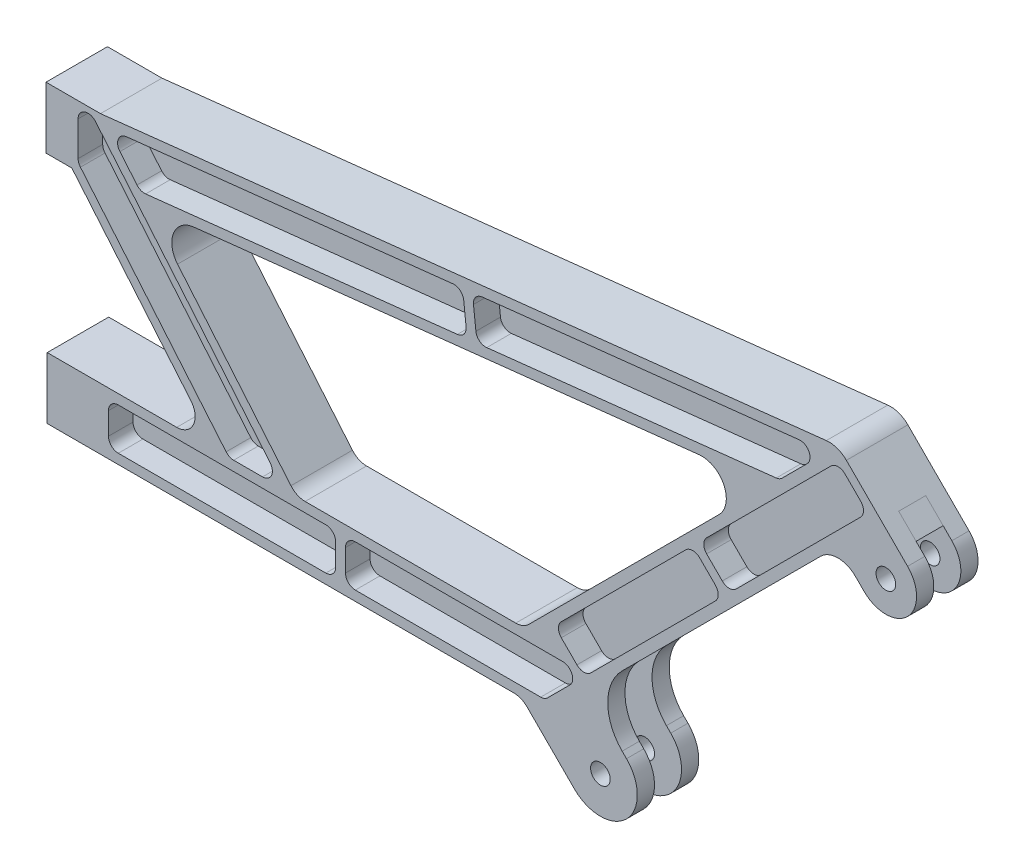
from build123d import *

# Parameters (mm, degrees)
SKETCH1_R               = 4
BOSS_EXTRUDE1_DEPTH     = 25
CUT_EXTRUDE1_DEPTH      = 10
CUT_EXTRUDE2_DEPTH      = 5.5
CUT_EXTRUDE2_DEPTH_BACK = 5.5
SKETCH4_W               = 11
SKETCH4_H               = 25.001230537
BOSS_EXTRUDE2_DEPTH     = 10


with BuildPart() as part:
    # Sketch1 → Boss-Extrude1 (new body)
    with BuildSketch(Plane.XY):
        with BuildLine():
            Line((-16.049733998, 33.731487379), (8.839559806, 8.838109599))
            ThreePointArc((8.839559806, 8.838109599), (12.499999987, -0.000512728), (8.838834763, -8.838834767))
            ThreePointArc((8.838834763, -8.838834767), (-2e-09, -12.5), (-8.838834765, -8.838834765))
            Line((-8.838834765, -8.838834765), (-12.374368672, -5.303300858))
            ThreePointArc((-12.374368672, -5.303300858), (-19.445436483, -2.37436867), (-26.516504295, -5.303300858))
            Line((-26.516504295, -5.303300858), (-107.248737345, -86.035533908))
            ThreePointArc((-107.248737345, -86.035533908), (-113.106601722, -100.177669532), (-107.248737345, -114.319805156))
            Line((-107.248737345, -114.319805156), (-105.480970392, -116.087572109))
            ThreePointArc((-105.480970392, -116.087572109), (-101.08757211, -126.694173826), (-105.480970392, -137.300775544))
            ThreePointArc((-105.480970392, -137.300775544), (-116.08757211, -141.694173826), (-126.694173828, -137.300775544))
            Line((-126.694173828, -137.300775544), (-145.95818419, -118.036765182))
            ThreePointArc((-145.95818419, -118.036765182), (-148.391359307, -116.410969547), (-151.261485049, -115.840066041))
            Line((-151.261485049, -115.840066041), (-341.190225323, -115.840066041))
            Line((-341.190225323, -115.840066041), (-341.084376622, -90.840290121))
            Line((-341.084376622, -90.840290121), (-288.42212085, -90.840290121))
            ThreePointArc((-288.42212085, -90.840290121), (-281.624812447, -86.509927084), (-282.676787526, -78.519383048))
            Line((-282.676787526, -78.519383048), (-331.075293128, -20.840290121))
            Line((-331.075293128, -20.840290121), (-341.577601674, -20.840290121))
            Line((-341.577601674, -20.840290121), (-341.577601674, 4.159709879))
            Line((-341.577601674, 4.159709879), (-319.417601674, 4.159709879))
            Line((-319.417601674, 4.159709879), (-24.213756083, 36.601156542))
            ThreePointArc((-24.213756083, 36.601156542), (-19.80525783, 36.095156835), (-16.049733998, 33.731487379))
        make_face()
        with Locations((-116.08757211, -126.694173826)):
            Circle(SKETCH1_R, mode=Mode.SUBTRACT)
        with Locations((-3e-09, -3e-09)):
            Circle(SKETCH1_R, mode=Mode.SUBTRACT)
        with BuildLine():
            Line((-241.951350625, -88.160973113), (-288.0752401, -33.192662128))
            ThreePointArc((-288.0752401, -33.192662128), (-289.695479067, -23.040686724), (-281.507169883, -16.824629162))
            Line((-281.507169883, -16.824629162), (-75.981590903, 5.7616183))
            ThreePointArc((-75.981590903, 5.7616183), (-65.873583845, 0.147933947), (-67.818148877, -11.24960638))
            Line((-67.818148877, -11.24960638), (-145.211909396, -88.643366899))
            ThreePointArc((-145.211909396, -88.643366899), (-147.645084512, -90.269162534), (-150.515210255, -90.840066041))
            Line((-150.515210255, -90.840066041), (-236.206017302, -90.840066041))
            ThreePointArc((-236.206017302, -90.840066041), (-239.375654265, -90.137374443), (-241.951350625, -88.160973113))
        make_face(mode=Mode.SUBTRACT)
    extrude(amount=BOSS_EXTRUDE1_DEPTH)

    # Sketch2 → Cut-Extrude1 (cut)
    with BuildSketch(Plane.XY.offset(25)):
        with BuildLine():
            ThreePointArc((-140.366977977, -111.840066041), (-138.836244247, -111.535584171), (-137.538550852, -110.668493165))
            Line((-137.538550852, -110.668493165), (-128.538550852, -101.668493165))
            ThreePointArc((-128.538550852, -101.668493165), (-127.671459847, -97.309332311), (-131.366977977, -94.840066041))
            Line((-131.366977977, -94.840066041), (-215.770021637, -94.840066041))
            ThreePointArc((-215.770021637, -94.840066041), (-218.598448762, -96.011638916), (-219.770021637, -98.840066041))
            Line((-219.770021637, -98.840066041), (-219.770021637, -107.840066041))
            ThreePointArc((-219.770021637, -107.840066041), (-218.598448762, -110.668493165), (-215.770021637, -111.840066041))
            Line((-215.770021637, -111.840066041), (-140.366977977, -111.840066041))
        make_face()
        with BuildLine():
            ThreePointArc((-16.614921093, 28.639448842), (-19.443416168, 29.811253755), (-22.272007364, 28.639680883))
            Line((-22.272007364, 28.639680883), (-72.893028462, -21.981340215))
            ThreePointArc((-72.893028462, -21.981340215), (-74.064601337, -24.80976734), (-72.893028462, -27.638194464))
            Line((-72.893028462, -27.638194464), (-66.529067431, -34.002155495))
            ThreePointArc((-66.529067431, -34.002155495), (-63.700640306, -35.17372837), (-60.872213182, -34.002155495))
            Line((-60.872213182, -34.002155495), (-10.251714155, 16.618343532))
            ThreePointArc((-10.251714155, 16.618343532), (-9.080141283, 19.446606586), (-10.251482133, 22.274965741))
            Line((-10.251482133, 22.274965741), (-16.614921093, 28.639448842))
        make_face()
        with BuildLine():
            ThreePointArc((-125.633513656, -93.10660172), (-122.805086531, -94.278174595), (-119.976659407, -93.10660172))
            Line((-119.976659407, -93.10660172), (-69.357494556, -42.487436869))
            ThreePointArc((-69.357494556, -42.487436869), (-68.185921681, -39.659009745), (-69.357494556, -36.83058262))
            Line((-69.357494556, -36.83058262), (-75.721455587, -30.466621589))
            ThreePointArc((-75.721455587, -30.466621589), (-78.549882711, -29.295048714), (-81.378309836, -30.466621589))
            Line((-81.378309836, -30.466621589), (-131.997474687, -81.08578644))
            ThreePointArc((-131.997474687, -81.08578644), (-133.169047562, -83.914213565), (-131.997474687, -86.742640689))
            Line((-131.997474687, -86.742640689), (-125.633513656, -93.10660172))
        make_face()
        with BuildLine():
            ThreePointArc((-316.173065297, -107.840066041), (-315.001492422, -110.668493165), (-312.173065297, -111.840066041))
            Line((-312.173065297, -111.840066041), (-227.770021637, -111.840066041))
            ThreePointArc((-227.770021637, -111.840066041), (-224.941594512, -110.668493165), (-223.770021637, -107.840066041))
            Line((-223.770021637, -107.840066041), (-223.770021637, -98.840066041))
            ThreePointArc((-223.770021637, -98.840066041), (-224.941594512, -96.011638916), (-227.770021637, -94.840066041))
            Line((-227.770021637, -94.840066041), (-312.173065297, -94.840066041))
            ThreePointArc((-312.173065297, -94.840066041), (-315.001492422, -96.011638916), (-316.173065297, -98.840066041))
            Line((-316.173065297, -98.840066041), (-316.173065297, -107.840066041))
        make_face()
        with BuildLine():
            Line((-328.507881243, -2.219721773), (-328.507881243, -16.221236214))
            ThreePointArc((-328.507881243, -16.221236214), (-328.266651726, -17.589316788), (-327.572059015, -18.792386653))
            Line((-327.572059015, -18.792386653), (-268.315720364, -89.411341125))
            ThreePointArc((-268.315720364, -89.411341125), (-266.942007859, -90.465425462), (-265.251525425, -90.840190686))
            Line((-265.251525425, -90.840190686), (-253.502902127, -90.840140268))
            ThreePointArc((-253.502902127, -90.840140268), (-249.877684517, -88.530605537), (-250.43874152, -84.26898983))
            Line((-250.43874152, -84.26898983), (-321.44370347, 0.351428666))
            ThreePointArc((-321.44370347, 0.351428666), (-325.875961816, 1.53904871), (-328.507881243, -2.219721773))
        make_face()
        with BuildLine():
            Line((-176.109143129, 15.884521302), (-308.890718748, 1.292481031))
            ThreePointArc((-308.890718748, 1.292481031), (-312.166042422, -1.193941994), (-311.517946835, -5.254732156))
            Line((-311.517946835, -5.254732156), (-304.562012149, -13.544492307))
            ThreePointArc((-304.562012149, -13.544492307), (-302.9874741, -14.685615228), (-301.060884691, -14.949404616))
            Line((-301.060884691, -14.949404616), (-174.252106965, -1.013745374))
            ThreePointArc((-174.252106965, -1.013745374), (-171.568585634, 0.459786528), (-170.712993903, 3.399267059))
            Line((-170.712993903, 3.399267059), (-171.696130696, 12.345408241))
            ThreePointArc((-171.696130696, 12.345408241), (-173.169662598, 15.028929572), (-176.109143129, 15.884521302))
        make_face()
        with BuildLine():
            Line((-42.183809279, 14.384733217), (-32.011769174, 24.556773322))
            ThreePointArc((-32.011769174, 24.556773322), (-31.233943162, 29.115789453), (-35.277145985, 31.361263195))
            Line((-35.277145985, 31.361263195), (-164.180954887, 17.19537036))
            ThreePointArc((-164.180954887, 17.19537036), (-166.864476218, 15.721838457), (-167.720067949, 12.782357926))
            Line((-167.720067949, 12.782357926), (-166.736931156, 3.836216744))
            ThreePointArc((-166.736931156, 3.836216744), (-165.263399254, 1.152695413), (-162.323918722, 0.297103683))
            Line((-162.323918722, 0.297103683), (-44.575286718, 13.237097595))
            ThreePointArc((-44.575286718, 13.237097595), (-43.281647397, 13.606907205), (-42.183809279, 14.384733217))
        make_face()
    cut_extrude1 = extrude(amount=-CUT_EXTRUDE1_DEPTH, mode=Mode.SUBTRACT)

    # Mirror1: Cut-Extrude1 across plane
    add(cut_extrude1.mirror(Plane.XY.offset(12.5)), mode=Mode.SUBTRACT)

    # Sketch3 → Cut-Extrude2 (cut, two sides: drawn at the far end of the back side and taken through both)
    with BuildSketch(Plane.XY.offset(12.5).offset(-CUT_EXTRUDE2_DEPTH_BACK)):
        with BuildLine():
            Line((-151.261485049, -115.840066041), (-141.195405101, -115.840066041))
            ThreePointArc((-141.195405101, -115.840066041), (-137.368570778, -115.078861366), (-134.12433729, -112.911133852))
            Line((-134.12433729, -112.911133852), (-98.96898095, -77.755777513))
            Line((-98.96898095, -77.755777513), (-66.359743398, -110.018550272))
            Line((-66.359743398, -110.018550272), (-116.59713847, -149.218566919))
            Line((-116.59713847, -149.218566919), (-151.261485049, -115.840066041))
        make_face()
        Polygon((-29.015558543, -7.802355106), (7.869814205, 29.083017642), (26.353299235, -15.387889097), (-12.04102058, -17.818970482), align=None)
    extrude(amount=CUT_EXTRUDE2_DEPTH + CUT_EXTRUDE2_DEPTH_BACK, mode=Mode.SUBTRACT)

    # Sketch4 → Boss-Extrude2 (add)
    with BuildSketch(Plane(origin=(-10.606601719, 10.606601719, 0), x_dir=(0, 0, -1), z_dir=(0.7071067811865439, -0.7071067811865511, 0))):
        with Locations((-12.5, 0.000615269)):
            Rectangle(SKETCH4_W, SKETCH4_H)
    extrude(amount=BOSS_EXTRUDE2_DEPTH)


solid = part.part
